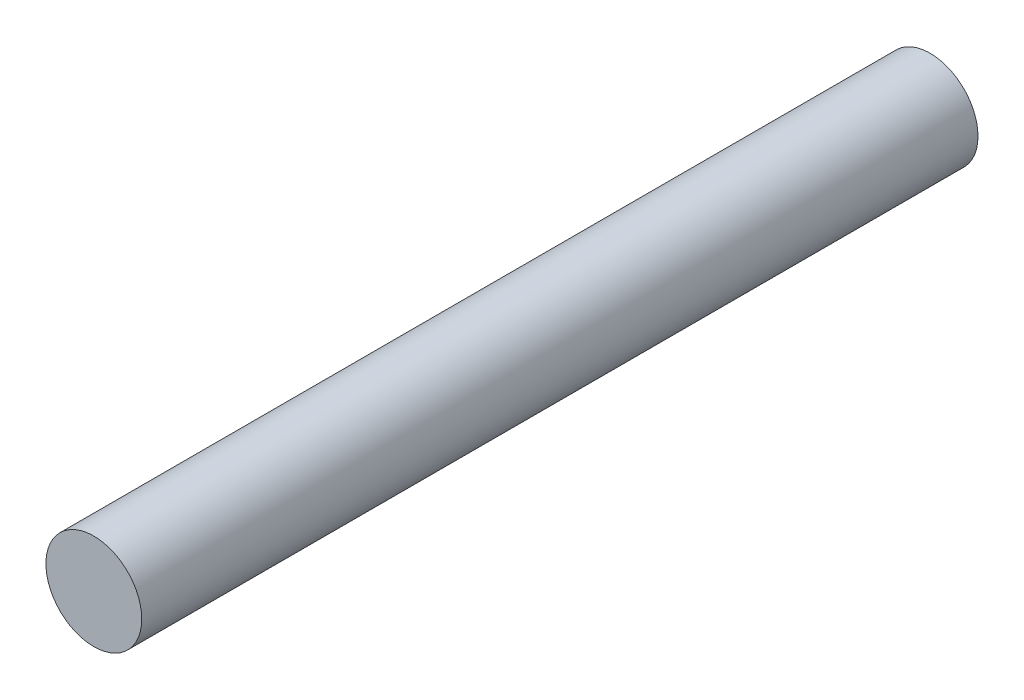
from build123d import *

# Parameters (mm, degrees)
CROQUIS1_R              = 2.75
SALIENTE_EXTRUIR1_DEPTH = 48


with BuildPart() as part:
    # Croquis1 → Saliente-Extruir1 (new body)
    with BuildSketch(Plane.XY):
        Circle(CROQUIS1_R)
    extrude(amount=SALIENTE_EXTRUIR1_DEPTH)


solid = part.part
